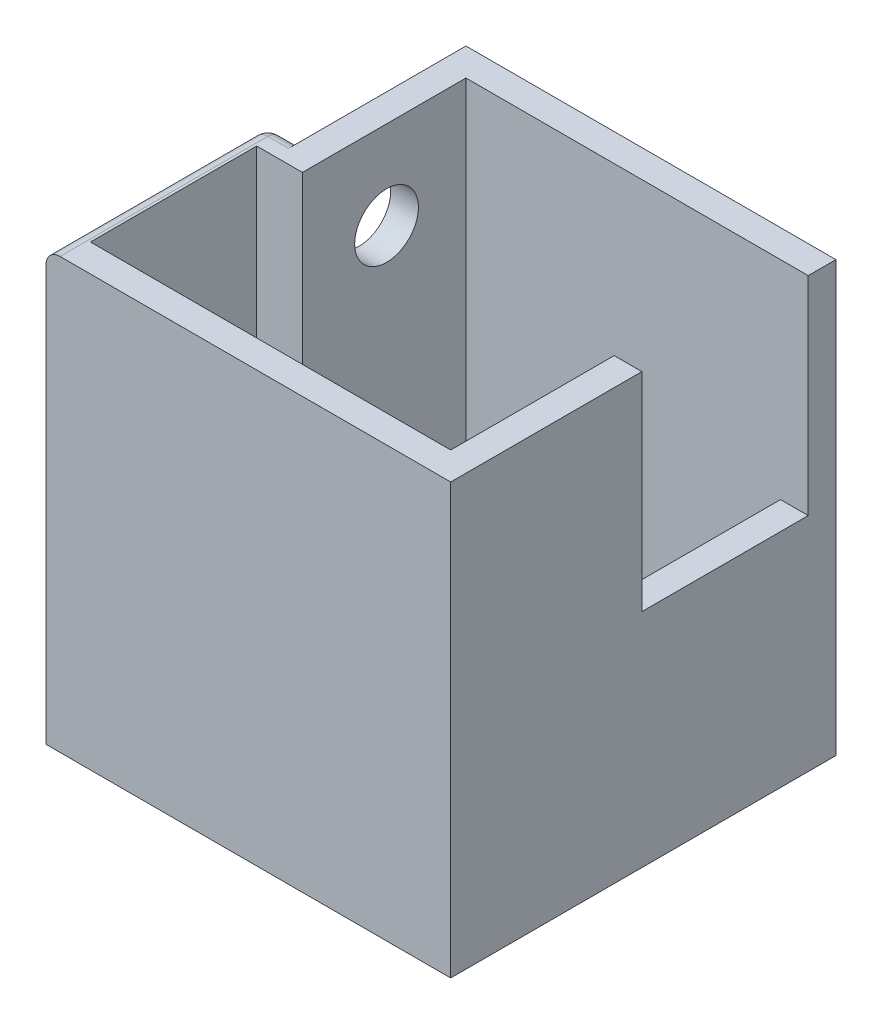
from build123d import *

# Parameters (mm, degrees)
ESQUISSE1_W             = 30
ESQUISSE1_H             = 31
BOSS_EXTRU_1_DEPTH      = 27.8
COQUE1_T                = -2
ENL_V_MAT_EXTRU_1_REACH = 53.321
ESQUISSE2_W             = 12
ESQUISSE2_H             = 15
ENL_V_MAT_EXTRU_2_REACH = 52.138
ESQUISSE3_W             = 15
ESQUISSE3_H             = 12
ESQUISSE4_W             = 26
ESQUISSE4_H             = 11.8
BOSS_EXTRU_2_DEPTH      = 1.5
ESQUISSE5_W             = 11.8
ESQUISSE5_H             = 27.5
BOSS_EXTRU_3_DEPTH      = 3.3
ESQUISSE6_W             = 2.1
ESQUISSE6_H             = 12
BOSS_EXTRU_4_DEPTH      = 6.3
ESQUISSE8_W             = 11.8
ESQUISSE8_H             = 31
ENL_V_MAT_EXTRU_3_DEPTH = 3.3
ENL_V_MAT_EXTRU_4_REACH = 51.464
ESQUISSE10_R            = 2.3
ENL_V_MAT_EXTRU_5_REACH = 53.321
ESQUISSE14_W            = 0.8
ESQUISSE14_H            = 16
CONG_2_R                = 1
CONG_3_R                = 1


with BuildPart() as part:
    # Esquisse1 → Boss.-Extru.1 (new body)
    with BuildSketch(Plane.XY):
        with Locations((15, 15.5)):
            Rectangle(ESQUISSE1_W, ESQUISSE1_H)
    extrude(amount=BOSS_EXTRU_1_DEPTH)

    # Coque1
    coque1_openings = [part.faces().sort_by_distance(p)[0] for p in [
        (15, 31, 13.9),
    ]]
    offset(amount=COQUE1_T, openings=coque1_openings, kind=Kind.INTERSECTION)

    # Esquisse2 → Enlèv. mat.-Extru.1 (cut, up to next)
    with BuildSketch(Plane(origin=(30, 0, 0), x_dir=(0, 0, -1), z_dir=(1, 0, 0)), mode=Mode.PRIVATE) as enl_v_mat_extru_1_sk1:
        with Locations((-8, 23.5)):
            Rectangle(ESQUISSE2_W, ESQUISSE2_H)
    enl_v_mat_extru_1_tool1 = extrude(enl_v_mat_extru_1_sk1.sketch, amount=-ENL_V_MAT_EXTRU_1_REACH, mode=Mode.PRIVATE) & part.part
    add(enl_v_mat_extru_1_tool1.solids().sort_by_distance((30, 23.5, 8))[0], mode=Mode.SUBTRACT)

    # Esquisse3 → Enlèv. mat.-Extru.2 (cut, up to next)
    with BuildSketch(Plane(origin=(0, 2, 0), x_dir=(1, 0, 0), z_dir=(0, 1, 0)), mode=Mode.PRIVATE) as enl_v_mat_extru_2_sk1:
        with Locations((11.6, -19.8)):
            Rectangle(ESQUISSE3_W, ESQUISSE3_H)
    enl_v_mat_extru_2_tool1 = extrude(enl_v_mat_extru_2_sk1.sketch, amount=-ENL_V_MAT_EXTRU_2_REACH, mode=Mode.PRIVATE) & part.part
    add(enl_v_mat_extru_2_tool1.solids().sort_by_distance((11.6, 2, 19.8))[0], mode=Mode.SUBTRACT)

    # Esquisse4 → Boss.-Extru.2 (add)
    with BuildSketch(Plane(origin=(0, 2, 0), x_dir=(1, 0, 0), z_dir=(0, 1, 0))):
        with Locations((15, -7.9)):
            Rectangle(ESQUISSE4_W, ESQUISSE4_H)
    extrude(amount=BOSS_EXTRU_2_DEPTH)

    # Esquisse5 → Boss.-Extru.3 (add)
    with BuildSketch(Plane(origin=(2, 0, 0), x_dir=(0, 0, -1), z_dir=(1, 0, 0))):
        with Locations((-7.9, 17.25)):
            Rectangle(ESQUISSE5_W, ESQUISSE5_H)
    extrude(amount=BOSS_EXTRU_3_DEPTH)

    # Esquisse6 → Boss.-Extru.4 (add)
    with BuildSketch(Plane(origin=(0, 2, 0), x_dir=(1, 0, 0), z_dir=(0, 1, 0))):
        with Locations((3.05, -19.8)):
            Rectangle(ESQUISSE6_W, ESQUISSE6_H)
    extrude(amount=BOSS_EXTRU_4_DEPTH)

    # Esquisse8 → Enlèv. mat.-Extru.3 (cut)
    with BuildSketch(Plane.ZY):
        with Locations((5.9, 15.5)):
            Rectangle(ESQUISSE8_W, ESQUISSE8_H)
    extrude(amount=-ENL_V_MAT_EXTRU_3_DEPTH, mode=Mode.SUBTRACT)

    # Esquisse10 → Enlèv. mat.-Extru.4 (cut, up to next)
    with BuildSketch(Plane.ZY.offset(-3.3), mode=Mode.PRIVATE) as enl_v_mat_extru_4_sk1:
        with Locations((7.73, 24.64)):
            Circle(ESQUISSE10_R)
    enl_v_mat_extru_4_tool1 = extrude(enl_v_mat_extru_4_sk1.sketch, amount=-ENL_V_MAT_EXTRU_4_REACH, mode=Mode.PRIVATE) & part.part
    add(enl_v_mat_extru_4_tool1.solids().sort_by_distance((3.3, 24.64, 7.73))[0], mode=Mode.SUBTRACT)

    # Esquisse14 → Enlèv. mat.-Extru.5 (cut, up to next)
    with BuildSketch(Plane(origin=(0, 31, 0), x_dir=(1, 0, 0), z_dir=(0, 1, 0)), mode=Mode.PRIVATE) as enl_v_mat_extru_5_sk1:
        with Locations((0.4, -19.8)):
            Rectangle(ESQUISSE14_W, ESQUISSE14_H)
    enl_v_mat_extru_5_tool1 = extrude(enl_v_mat_extru_5_sk1.sketch, amount=-ENL_V_MAT_EXTRU_5_REACH, mode=Mode.PRIVATE) & part.part
    add(enl_v_mat_extru_5_tool1.solids().sort_by_distance((0.4, 31, 19.8))[0], mode=Mode.SUBTRACT)

    # Congé2
    cong_2_edges = [part.edges().sort_by_distance(p)[0] for p in [
        (2.05, 31, 11.8),
    ]]
    fillet(cong_2_edges, radius=CONG_2_R)

    # Congé3
    cong_3_edges = [part.edges().sort_by_distance(p)[0] for p in [
        (0.8, 15, 11.8),
        (0.8, 30.707106781, 12.092893219),
        (0.8, 31, 20.3),
    ]]
    fillet(cong_3_edges, radius=CONG_3_R)


solid = part.part
